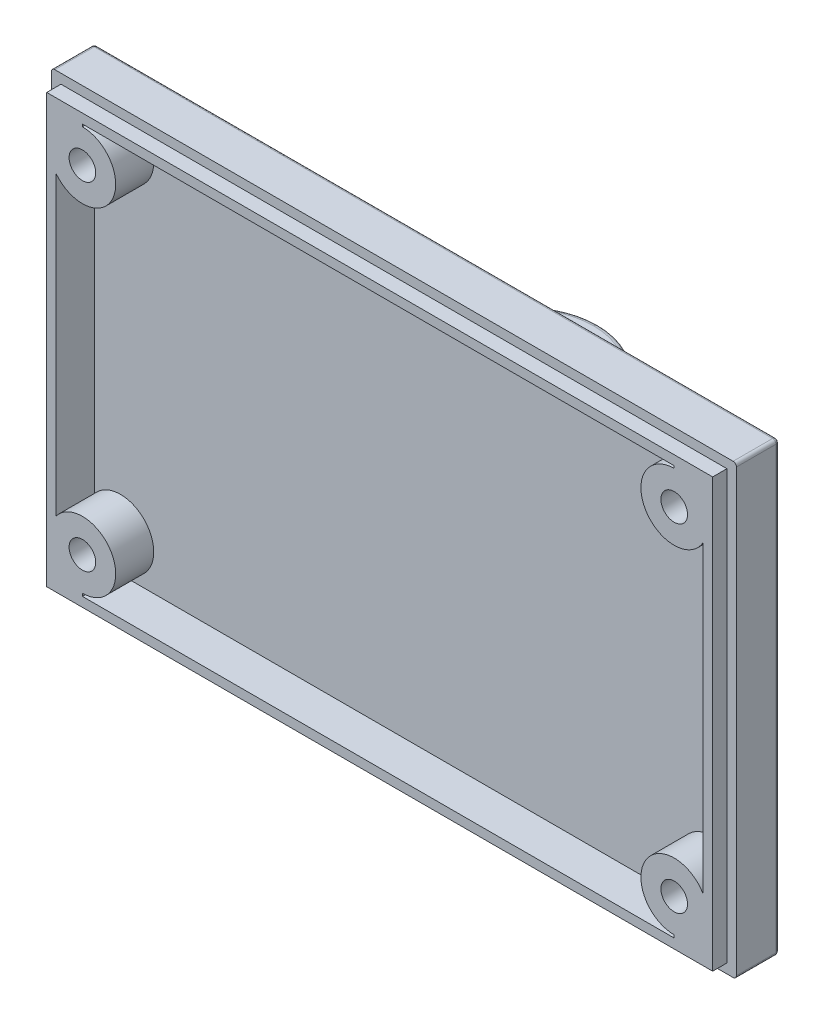
from build123d import *

# Parameters (mm, degrees)
SKETCH1_W           = 72
SKETCH1_H           = 47
BOSS_EXTRUDE1_DEPTH = 6
SHELL1_T            = -2
SKETCH3_OUTSIDE_W   = 91.238
SKETCH3_OUTSIDE_H   = 66.238
SKETCH3_OUTSIDE_W_2 = 70
SKETCH3_OUTSIDE_H_2 = 45
CUT_EXTRUDE1_DEPTH  = 1.5
SKETCH2_R           = 3.5
BOSS_EXTRUDE2_DEPTH = 4
SKETCH4_W           = 2.75
SKETCH4_H           = 3.79
SKETCH4_H_2         = 3.75
SKETCH4_W_2         = 3.04
BOSS_EXTRUDE3_DEPTH = 4
SKETCH5_R           = 1.4
CUT_EXTRUDE2_DEPTH  = 44.407948581
SKETCH6_R           = 2.75
CUT_EXTRUDE3_DEPTH  = 3
SKETCH7_W           = 16
SKETCH7_H           = 3
BOSS_EXTRUDE5_DEPTH = 17
FILLET2_R           = 8
SKETCH9_R           = 1.5
CUT_EXTRUDE5_DEPTH  = 51.457903246
FILLET3_R           = 0.35
FILLET4_R           = 0.5
FILLET5_R           = 0.8
FILLET6_R           = 0.35


# Some blends are built 0.0001 mm under size
with BuildPart() as part:
    # Sketch1 → Boss-Extrude1 (new body)
    with BuildSketch(Plane.XY):
        Rectangle(SKETCH1_W, SKETCH1_H)
    extrude(amount=BOSS_EXTRUDE1_DEPTH)

    # Shell1
    shell1_openings = [part.faces().sort_by_distance(p)[0] for p in [
        (0, 0, 6),
    ]]
    offset(amount=SHELL1_T, openings=shell1_openings, kind=Kind.INTERSECTION)

    # Sketch3 outside → Cut-Extrude1 (cut)
    with BuildSketch(Plane.XY.offset(6)):
        Rectangle(SKETCH3_OUTSIDE_W, SKETCH3_OUTSIDE_H)
        Rectangle(SKETCH3_OUTSIDE_W_2, SKETCH3_OUTSIDE_H_2, mode=Mode.SUBTRACT)
    extrude(amount=-CUT_EXTRUDE1_DEPTH, mode=Mode.SUBTRACT)

    # Sketch2 → Boss-Extrude2 (add)
    with BuildSketch(Plane.XY.offset(2)):
        with Locations((-31.25, 17.75)):
            Circle(SKETCH2_R)
        with Locations((30.96, 17.75)):
            Circle(SKETCH2_R)
        with Locations((-31.25, -17.71)):
            Circle(SKETCH2_R)
        with Locations((30.96, -17.71)):
            Circle(SKETCH2_R)
    extrude(amount=BOSS_EXTRUDE2_DEPTH)

    # Sketch4 → Boss-Extrude3 (add)
    with BuildSketch(Plane.XY.offset(2)):
        with Locations((-32.625, -19.605)):
            Rectangle(SKETCH4_W, SKETCH4_H)
        with Locations((-32.625, 19.625)):
            Rectangle(SKETCH4_W, SKETCH4_H_2)
        with Locations((32.48, 19.625)):
            Rectangle(SKETCH4_W_2, SKETCH4_H_2)
        with Locations((32.48, -19.605)):
            Rectangle(SKETCH4_W_2, SKETCH4_H)
    extrude(amount=BOSS_EXTRUDE3_DEPTH)

    # Sketch5 → Cut-Extrude2 (cut, through all)
    with BuildSketch(Plane.XY.offset(6)):
        with Locations((30.96, -17.71)):
            Circle(SKETCH5_R)
        with Locations((30.96, 17.75)):
            Circle(SKETCH5_R)
        with Locations((-31.25, -17.71)):
            Circle(SKETCH5_R)
        with Locations((-31.25, 17.75)):
            Circle(SKETCH5_R)
    extrude(amount=-CUT_EXTRUDE2_DEPTH, mode=Mode.SUBTRACT)

    # Sketch6 → Cut-Extrude3 (cut)
    with BuildSketch(Plane(origin=(0, 0, 0), x_dir=(-1, 0, 0), z_dir=(0, 0, -1))):
        with Locations((31.25, 17.75)):
            Circle(SKETCH6_R)
        with Locations((-30.96, 17.75)):
            Circle(SKETCH6_R)
        with Locations((31.25, -17.71)):
            Circle(SKETCH6_R)
        with Locations((-30.96, -17.71)):
            Circle(SKETCH6_R)
    extrude(amount=-CUT_EXTRUDE3_DEPTH, mode=Mode.SUBTRACT)

    # Sketch7 → Boss-Extrude5 (add)
    with BuildSketch(Plane(origin=(0, 0, 0), x_dir=(-1, 0, 0), z_dir=(0, 0, -1))):
        Rectangle(SKETCH7_W, SKETCH7_H)
        with Locations((0, 6)):
            Rectangle(SKETCH7_W, SKETCH7_H)
        with Locations((0, -6)):
            Rectangle(SKETCH7_W, SKETCH7_H)
    extrude(amount=BOSS_EXTRUDE5_DEPTH)

    # Fillet2
    fillet2_edges = [part.edges().sort_by_distance(p)[0] for p in [
        (8, -6, -17),
        (8, 0, -17),
        (8, 6, -17),
        (-8, 6, -17),
        (-8, 0, -17),
        (-8, -6, -17),
    ]]
    fillet(fillet2_edges, radius=FILLET2_R - 0.0001)  # a hair under: the kernel refuses the full size

    # Sketch9 → Cut-Extrude5 (cut, through all)
    with BuildSketch(Plane.XZ.offset(7.5)):
        with Locations((0, -9)):
            Circle(SKETCH9_R)
    extrude(amount=-CUT_EXTRUDE5_DEPTH, mode=Mode.SUBTRACT)

    # Fillet3
    fillet3_edges = [part.edges().sort_by_distance(p)[0] for p in [
        (0, 23.5, 0),
        (36, 0, 0),
        (0, -23.5, 0),
        (-36, 0, 0),
    ]]
    fillet(fillet3_edges, radius=FILLET3_R)

    # Fillet4
    fillet4_edges = [part.edges().sort_by_distance(p)[0] for p in [
        (-8, -7.5, -4.50005),
        (8, -7.5, -4.50005),
        (-5.656883539, -7.5, -14.656883539),
        (5.656883539, -7.5, -14.656883539),
        (8, -4.5, -4.50005),
        (-8, -4.5, -4.50005),
        (-5.656883539, -4.5, -14.656883539),
        (5.656883539, -4.5, -14.656883539),
        (-8, -1.5, -4.50005),
        (8, -1.5, -4.50005),
        (-5.656883539, -1.5, -14.656883539),
        (5.656883539, -1.5, -14.656883539),
        (8, 1.5, -4.50005),
        (-8, 1.5, -4.50005),
        (-5.656883539, 1.5, -14.656883539),
        (5.656883539, 1.5, -14.656883539),
        (-8, 4.5, -4.50005),
        (8, 4.5, -4.50005),
        (-5.656883539, 4.5, -14.656883539),
        (5.656883539, 4.5, -14.656883539),
        (8, 7.5, -4.50005),
        (-8, 7.5, -4.50005),
        (-5.656883539, 7.5, -14.656883539),
        (5.656883539, 7.5, -14.656883539),
    ]]
    fillet(fillet4_edges, radius=FILLET4_R)

    # Fillet5
    fillet5_edges = [part.edges().sort_by_distance(p)[0] for p in [
        (0, 7.5, 0),
        (-8, 6, 0),
        (0, 1.5, 0),
        (-8, 0, 0),
        (0, 4.5, 0),
        (0, -1.5, 0),
        (0, -7.5, 0),
        (8, -6, 0),
        (0, -4.5, 0),
        (8, 6, 0),
        (8, 0, 0),
        (-8, -6, 0),
        (-7.853553391, 7.353553391, 0),
        (-7.853553391, 1.353553391, 0),
        (-7.853553391, 4.646446609, 0),
        (-7.853553391, -1.353553391, 0),
        (7.853553391, -7.353553391, 0),
        (7.853553391, -4.646446609, 0),
        (7.853553391, 7.353553391, 0),
        (7.853553391, 1.353553391, 0),
        (7.853553391, 4.646446609, 0),
        (7.853553391, -1.353553391, 0),
        (-7.853553391, -7.353553391, 0),
        (-7.853553391, -4.646446609, 0),
    ]]
    fillet(fillet5_edges, radius=FILLET5_R)

    # Fillet6
    # the kernel refuses this fillet: 0.35 mm, written as the material it takes off along each edge
    with BuildSketch(Plane(origin=(-35.65, -23.15, 0.35), x_dir=(0, -1, 0), z_dir=(-1, 0, 0))) as fillet6_piece_1_section:
        Polygon((0, 0), (FILLET6_R, 0), (FILLET6_R, -FILLET6_R), (0, -FILLET6_R), align=None)
    fillet6_piece_1 = extrude(amount=FILLET6_R, mode=Mode.PRIVATE)
    fillet6_piece_1 = fillet6_piece_1 - Plane(origin=(-35.65, -23.15, 0.35), x_dir=(0, 0.7071067811865475, 0.7071067811865475), z_dir=(-1, 0, 0)) * Sphere(FILLET6_R, mode=Mode.PRIVATE)
    add(fillet6_piece_1, mode=Mode.SUBTRACT)
    with BuildSketch(Plane(origin=(-35.65, 23.15, 0.35), x_dir=(-1, 0, 0), z_dir=(0, 1, 0))) as fillet6_piece_2_section:
        Polygon((0, 0), (FILLET6_R, 0), (FILLET6_R, -FILLET6_R), (0, -FILLET6_R), align=None)
    fillet6_piece_2 = extrude(amount=FILLET6_R, mode=Mode.PRIVATE)
    fillet6_piece_2 = fillet6_piece_2 - Plane(origin=(-35.65, 23.15, 0.35), x_dir=(0.7071067811865475, 0, 0.7071067811865475), z_dir=(0, 1, 0)) * Sphere(FILLET6_R, mode=Mode.PRIVATE)
    add(fillet6_piece_2, mode=Mode.SUBTRACT)
    with BuildSketch(Plane(origin=(35.65, -23.15, 0.35), x_dir=(0, -1, 0), z_dir=(1, 0, 0))) as fillet6_piece_3_section:
        Polygon((0, 0), (FILLET6_R, 0), (FILLET6_R, FILLET6_R), (0, FILLET6_R), align=None)
    fillet6_piece_3 = extrude(amount=FILLET6_R, mode=Mode.PRIVATE)
    fillet6_piece_3 = fillet6_piece_3 - Plane(origin=(35.65, -23.15, 0.35), x_dir=(0, 0.7071067811865475, 0.7071067811865475), z_dir=(1, 0, 0)) * Sphere(FILLET6_R, mode=Mode.PRIVATE)
    add(fillet6_piece_3, mode=Mode.SUBTRACT)
    with BuildSketch(Plane(origin=(35.65, 23.15, 0.35), x_dir=(1, 0, 0), z_dir=(0, 1, 0))) as fillet6_piece_4_section:
        Polygon((0, 0), (FILLET6_R, 0), (FILLET6_R, FILLET6_R), (0, FILLET6_R), align=None)
    fillet6_piece_4 = extrude(amount=FILLET6_R, mode=Mode.PRIVATE)
    fillet6_piece_4 = fillet6_piece_4 - Plane(origin=(35.65, 23.15, 0.35), x_dir=(-0.7071067811865475, 0, 0.7071067811865475), z_dir=(0, 1, 0)) * Sphere(FILLET6_R, mode=Mode.PRIVATE)
    add(fillet6_piece_4, mode=Mode.SUBTRACT)
    with BuildSketch(Plane(origin=(-36, 23.5, 0.35), x_dir=(1, 0, 0), z_dir=(0, 0, 1)), Plane(origin=(-36, -23.5, 0.35), x_dir=(0, 1, 0), z_dir=(0, 0, 1))) as fillet6_piece_5:
        with BuildLine():
            CenterArc((FILLET6_R, -FILLET6_R), FILLET6_R, 90, 90)
            Line((0, -FILLET6_R), (0, 0))
            Line((0, 0), (FILLET6_R, 0))
        make_face()
    extrude(amount=5.025, mode=Mode.SUBTRACT)
    with BuildSketch(Plane(origin=(36, 23.5, 0.35), x_dir=(-1, 0, 0), z_dir=(0, 0, 1)), Plane(origin=(36, -23.5, 0.35), x_dir=(0, 1, 0), z_dir=(0, 0, 1))) as fillet6_piece_6:
        with BuildLine():
            CenterArc((FILLET6_R, FILLET6_R), FILLET6_R, 180, 90)
            Line((0, FILLET6_R), (0, 0))
            Line((0, 0), (FILLET6_R, 0))
        make_face()
    extrude(amount=5.025, mode=Mode.SUBTRACT)


solid = part.part
